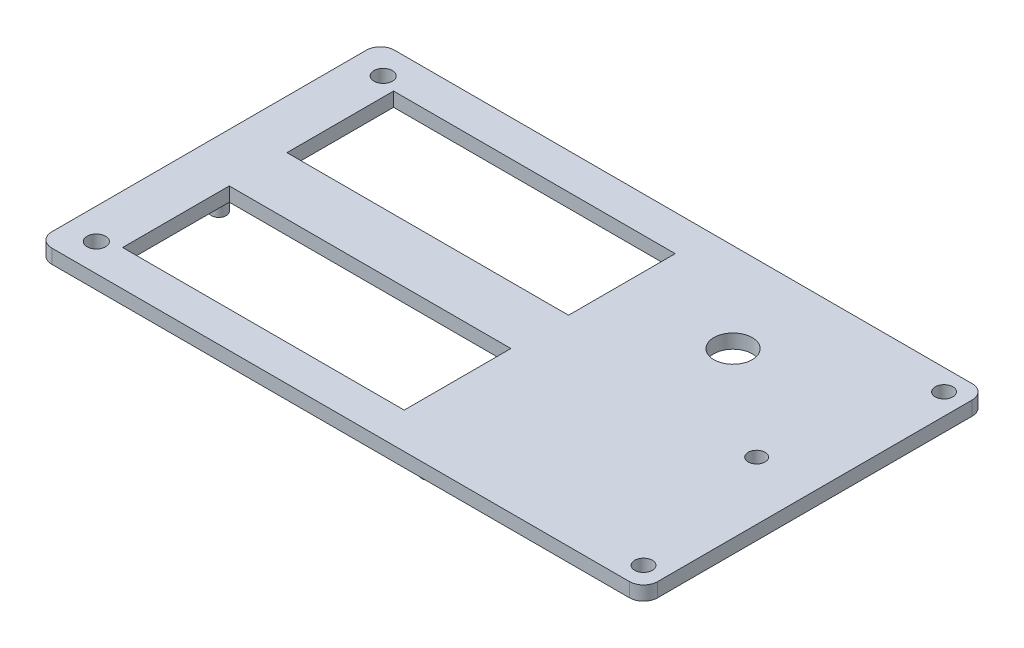
from build123d import *

# Parameters (mm, degrees)
SKETCH1_W           = 109.2835
SKETCH1_H           = 61.8236
SKETCH1_R           = 3.46075
SKETCH1_R_2         = 1.6637
SKETCH1_R_3         = 1.524
SKETCH1_R_4         = 1.5875
SKETCH1_W_2         = 50.8
SKETCH1_H_2         = 19.2405
BOSS_EXTRUDE1_DEPTH = 2.54
SKETCH5_W           = 2.54
SKETCH5_H           = 10.4775
SKETCH5_W_2         = 15.9385
SKETCH5_H_2         = 3.429
CUT_EXTRUDE1_DEPTH  = 1.905
FILLET1_R           = 1.27
FILLET2_R           = 2.54
SKETCH6_R           = 1.6637
BOSS_EXTRUDE2_DEPTH = 2.54
SKETCH7_R           = 1.3335
BOSS_EXTRUDE3_DEPTH = 3.81


with BuildPart() as part:
    # Sketch1 → Boss-Extrude1 (new body)
    with BuildSketch(Plane(origin=(0, 0, 0), x_dir=(1, 0, 0), z_dir=(0, 1, 0))):
        with Locations((19.08175, 0)):
            Rectangle(SKETCH1_W, SKETCH1_H)
        with Locations(Location((44.1325, 14.8209, 0), (0, 0, 270))):
            Circle(SKETCH1_R, mode=Mode.SUBTRACT)
        with Locations(Location((-30.02, 25.8718, 0), (0, 0, 270))):
            Circle(SKETCH1_R_2, mode=Mode.SUBTRACT)
        with Locations(Location((30.02, 25.8718, 0), (0, 0, 90))):
            Circle(SKETCH1_R_2, mode=Mode.SUBTRACT)
        with Locations(Location((-30.02, 3.77, 0), (0, 0, 90))):
            Circle(SKETCH1_R_2, mode=Mode.SUBTRACT)
        with Locations(Location((30.02, 3.77, 0), (0, 0, 270))):
            Circle(SKETCH1_R_2, mode=Mode.SUBTRACT)
        with Locations(Location((30.02, -3.77, 0), (0, 0, 90))):
            Circle(SKETCH1_R_2, mode=Mode.SUBTRACT)
        with Locations(Location((-30.02, -3.77, 0), (0, 0, 270))):
            Circle(SKETCH1_R_2, mode=Mode.SUBTRACT)
        with Locations(Location((-30.02, -25.8718, 0), (0, 0, 90))):
            Circle(SKETCH1_R_2, mode=Mode.SUBTRACT)
        with Locations(Location((30.02, -25.8718, 0), (0, 0, 270))):
            Circle(SKETCH1_R_2, mode=Mode.SUBTRACT)
        with Locations(Location((63.21425, 0, 0), (0, 0, 270))):
            Circle(SKETCH1_R_3, mode=Mode.SUBTRACT)
        with Locations(Location((69.9135, 27.1018, 0), (0, 0, 270))):
            Circle(SKETCH1_R_4, mode=Mode.SUBTRACT)
        with Locations(Location((69.9135, -27.1018, 0), (0, 0, 270))):
            Circle(SKETCH1_R_4, mode=Mode.SUBTRACT)
        with Locations((-1.32, 14.8209)):
            Rectangle(SKETCH1_W_2, SKETCH1_H_2, mode=Mode.SUBTRACT)
        with Locations((-1.32, -14.8209)):
            Rectangle(SKETCH1_W_2, SKETCH1_H_2, mode=Mode.SUBTRACT)
    extrude(amount=BOSS_EXTRUDE1_DEPTH)

    # Sketch5 → Cut-Extrude1 (cut)
    with BuildSketch(Plane.XZ):
        with Locations((27.255, -14.8209)):
            Rectangle(SKETCH5_W, SKETCH5_H)
        with Locations((27.255, 14.8209)):
            Rectangle(SKETCH5_W, SKETCH5_H)
        with Locations((63.21425, 14.351)):
            Rectangle(SKETCH5_W_2, SKETCH5_H_2)
    extrude(amount=-CUT_EXTRUDE1_DEPTH, mode=Mode.SUBTRACT)

    # Fillet1
    fillet1_edges = [part.edges().sort_by_distance(p)[0] for p in [
        (25.985, 1.905, -14.8209),
        (27.255, 1.905, -9.58215),
        (28.525, 1.905, -14.8209),
        (27.255, 1.905, -20.05965),
        (25.985, 1.905, 14.8209),
        (27.255, 1.905, 20.05965),
        (28.525, 1.905, 14.8209),
        (27.255, 1.905, 9.58215),
        (71.1835, 1.905, 14.351),
        (71.1835, 0.9525, 16.0655),
        (63.21425, 1.905, 12.6365),
        (71.1835, 0.9525, 12.6365),
        (55.245, 1.905, 14.351),
        (55.245, 0.9525, 12.6365),
        (63.21425, 1.905, 16.0655),
        (55.245, 0.9525, 16.0655),
    ]]
    fillet(fillet1_edges, radius=FILLET1_R - 0.0001)  # a hair under: the kernel refuses the full size

    # Fillet2
    fillet2_edges = [part.edges().sort_by_distance(p)[0] for p in [
        (-35.56, 1.27, -30.9118),
        (73.7235, 1.27, -30.9118),
        (73.7235, 1.27, 30.9118),
        (-35.56, 1.27, 30.9118),
    ]]
    fillet(fillet2_edges, radius=FILLET2_R)

    # Sketch6 → Boss-Extrude2 (add)
    with BuildSketch(Plane.XZ):
        with Locations((-30.02, 3.77)):
            Circle(SKETCH6_R)
        with Locations((-30.02, -3.77)):
            Circle(SKETCH6_R)
        with Locations((30.02, -25.8718)):
            Circle(SKETCH6_R)
        with Locations((30.02, 25.8718)):
            Circle(SKETCH6_R)
        with Locations((30.02, 3.77)):
            Circle(SKETCH6_R)
        with Locations((30.02, -3.77)):
            Circle(SKETCH6_R)
    extrude(amount=-BOSS_EXTRUDE2_DEPTH)

    # Sketch7 → Boss-Extrude3 (add)
    with BuildSketch(Plane.XZ):
        with Locations(Location((-30.02, 3.77, 0), (0, 0, 90))):
            Circle(SKETCH7_R)
        with Locations(Location((-30.02, -3.77, 0), (0, 0, 90))):
            Circle(SKETCH7_R)
        with Locations(Location((30.02, -25.8718, 0), (0, 0, 90))):
            Circle(SKETCH7_R)
        with Locations(Location((30.02, 25.8718, 0), (0, 0, 90))):
            Circle(SKETCH7_R)
        with Locations(Location((30.02, -3.77, 0), (0, 0, 90))):
            Circle(SKETCH7_R)
        with Locations(Location((30.02, 3.77, 0), (0, 0, 90))):
            Circle(SKETCH7_R)
    extrude(amount=BOSS_EXTRUDE3_DEPTH)


solid = part.part
